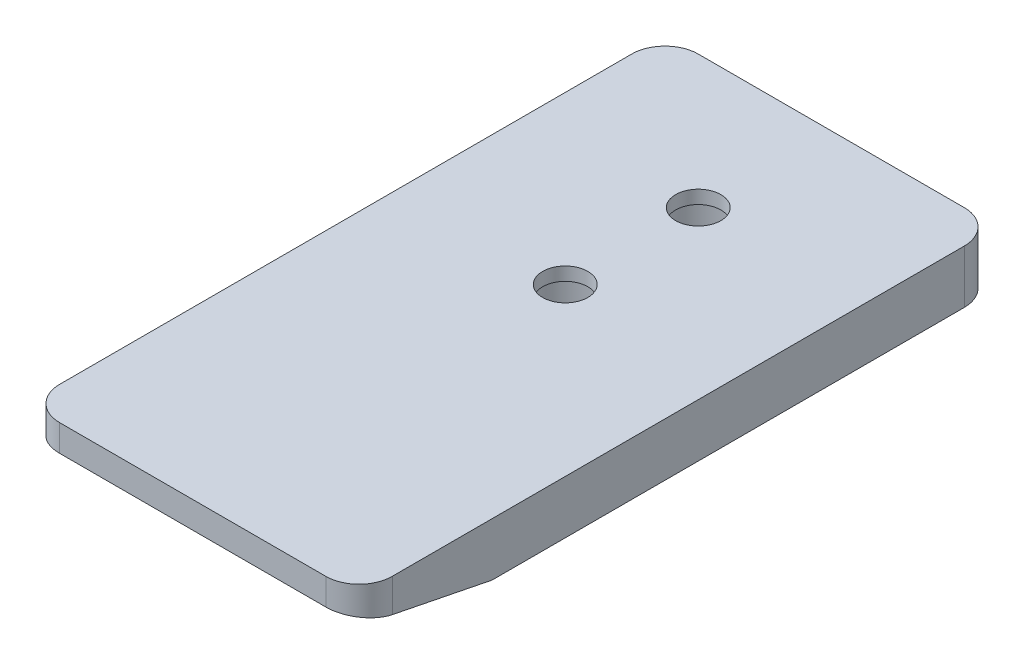
from build123d import *

# Parameters (mm, degrees)
SKETCH1_W                      = 25
SKETCH1_H                      = 30
BOSS_EXTRUDE1_DEPTH            = 4
CBORE_FOR_M3_SHCS2_D           = 3.4
CBORE_FOR_M3_SHCS2_CBORE_D     = 6.5
CBORE_FOR_M3_SHCS2_CBORE_DEPTH = 3
SKETCH5_W                      = 25
SKETCH5_H                      = 4
BOSS_EXTRUDE2_DEPTH            = 18
CHAMFER1_SIZE                  = 10
CHAMFER1_SIZE2                 = 2
FILLET1_R                      = 2.5


with BuildPart() as part:
    # Sketch1 → Boss-Extrude1 (new body)
    with BuildSketch(Plane(origin=(0, 0, 0), x_dir=(1, 0, 0), z_dir=(0, 1, 0))):
        with Locations((12.5, 15)):
            Rectangle(SKETCH1_W, SKETCH1_H)
    extrude(amount=BOSS_EXTRUDE1_DEPTH)

    # CBORE for M3 SHCS2 (through all)
    with Locations(Plane(origin=(0, 0, 0), x_dir=(-1, 0, 0), z_dir=(0, -1, 0))):
        with Locations((-12.5, 20), (-12.5, 10)):
            CounterBoreHole(CBORE_FOR_M3_SHCS2_D / 2, CBORE_FOR_M3_SHCS2_CBORE_D / 2, CBORE_FOR_M3_SHCS2_CBORE_DEPTH)

    # Sketch5 → Boss-Extrude2 (add)
    with BuildSketch(Plane.XY):
        with Locations((12.5, 2)):
            Rectangle(SKETCH5_W, SKETCH5_H)
    extrude(amount=BOSS_EXTRUDE2_DEPTH)

    # Chamfer1
    chamfer1_edges = [part.edges().sort_by_distance(p)[0] for p in [
        (12.5, 0, 18),
    ]]
    chamfer1_side = [part.faces().sort_by_distance(p)[0] for p in [
        (12.5, 0, -5.473114445),
    ]]
    chamfer(chamfer1_edges, length=CHAMFER1_SIZE, length2=CHAMFER1_SIZE2, reference=chamfer1_side[0])

    # Fillet1
    fillet1_edges = [part.edges().sort_by_distance(p)[0] for p in [
        (0, 2, -30),
        (25, 2, -30),
        (0, 3, 18),
        (25, 3, 18),
    ]]
    fillet(fillet1_edges, radius=FILLET1_R)


solid = part.part
